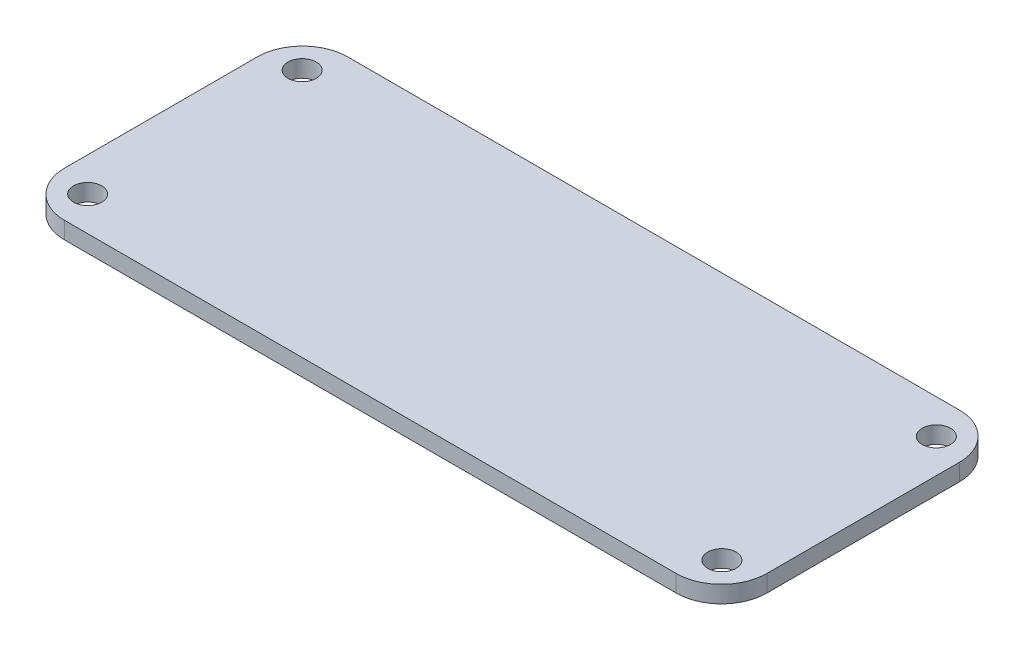
from build123d import *

# Parameters (mm, degrees)
CROQUIS1_W              = 62
CROQUIS1_H              = 25
SALIENTE_EXTRUIR1_DEPTH = 1.5
REDONDEO1_R             = 4
CROQUIS2_R              = 1.25
CORTAR_EXTRUIR1_DEPTH   = 10


with BuildPart() as part:
    # Croquis1 → Saliente-Extruir1 (new body)
    with BuildSketch(Plane(origin=(0, 0, 0), x_dir=(1, 0, 0), z_dir=(0, 1, 0))):
        Rectangle(CROQUIS1_W, CROQUIS1_H)
    extrude(amount=SALIENTE_EXTRUIR1_DEPTH)

    # Redondeo1
    redondeo1_edges = [part.edges().sort_by_distance(p)[0] for p in [
        (-31, 0.75, 12.5),
        (31, 0.75, 12.5),
        (31, 0.75, -12.5),
        (-31, 0.75, -12.5),
    ]]
    fillet(redondeo1_edges, radius=REDONDEO1_R)

    # Croquis2 → Cortar-Extruir1 (cut)
    with BuildSketch(Plane(origin=(0, 1.5, 0), x_dir=(1, 0, 0), z_dir=(0, 1, 0))):
        with Locations((-28, 9.47)):
            Circle(CROQUIS2_R)
        with Locations((28, 9.47)):
            Circle(CROQUIS2_R)
        with Locations((28, -9.47)):
            Circle(CROQUIS2_R)
        with Locations((-28, -9.47)):
            Circle(CROQUIS2_R)
    extrude(amount=-CORTAR_EXTRUIR1_DEPTH, mode=Mode.SUBTRACT)


solid = part.part
